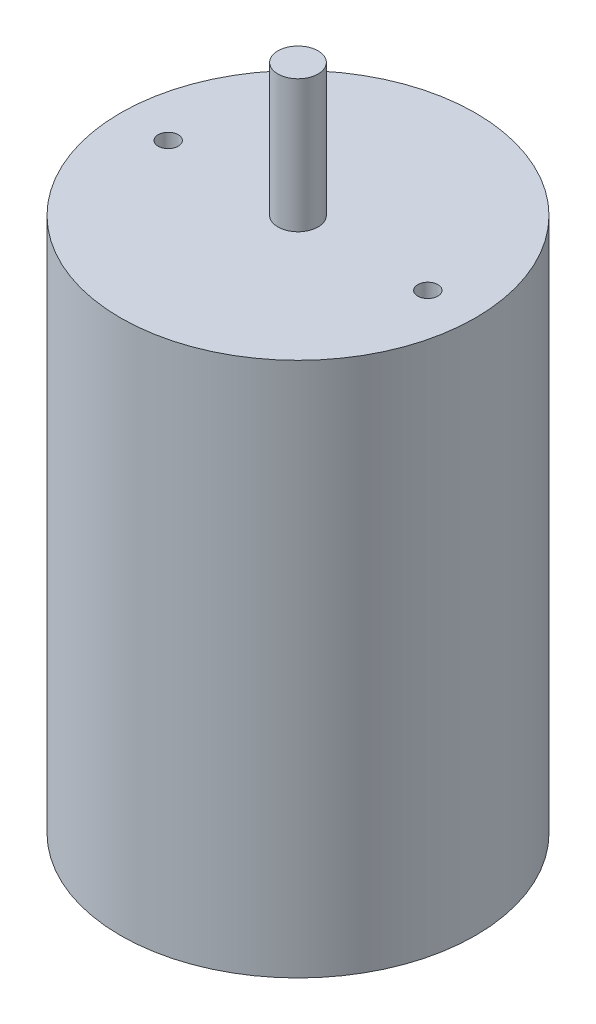
from build123d import *

# Parameters (mm, degrees)
SKETCH_1_R          = 22.1
EXTRUDE_1_DEPTH     = 66.6
SKETCH_2_R          = 2.5
EXTRUDE_2_DEPTH     = 16.5
EXTRUDE_START       = 5
SKETCH_3_R          = 2.5
EXTRUDE_3_DEPTH     = 5
SKETCH_4_R          = 1.25
CUT_EXTRUDE_1_DEPTH = 5


with BuildPart() as part:
    # 草圖1 → 填料-伸長1 (new body)
    with BuildSketch(Plane(origin=(0, 0, 0), x_dir=(1, 0, 0), z_dir=(0, 1, 0))):
        Circle(SKETCH_1_R)
    extrude(amount=EXTRUDE_1_DEPTH)

    # 草圖2 → 填料-伸長2 (add)
    with BuildSketch(Plane(origin=(0, 66.6, 0), x_dir=(1, 0, 0), z_dir=(0, 1, 0))):
        Circle(SKETCH_2_R)
    extrude(amount=EXTRUDE_2_DEPTH)

    # 草圖3 → 填料-伸長3 (add)
    with BuildSketch(Plane.XZ.offset(EXTRUDE_START)):
        Circle(SKETCH_3_R)
    extrude(amount=-EXTRUDE_3_DEPTH)

    # 草圖4 → 除料-伸長1 (cut)
    with BuildSketch(Plane(origin=(0, 66.6, 0), x_dir=(1, 0, 0), z_dir=(0, 1, 0))):
        with Locations((-16.165, 0)):
            Circle(SKETCH_4_R)
        with Locations((16.165, 0)):
            Circle(SKETCH_4_R)
    extrude(amount=-CUT_EXTRUDE_1_DEPTH, mode=Mode.SUBTRACT)


solid = part.part
